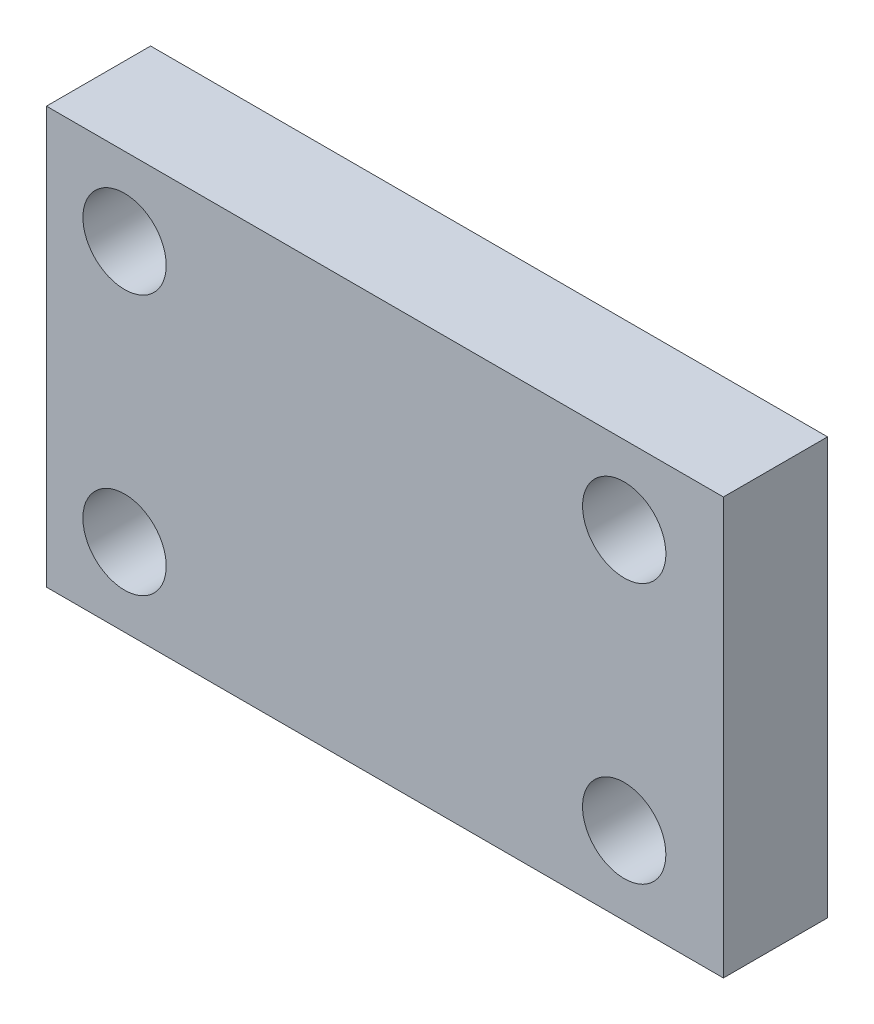
from build123d import *

# Parameters (mm, degrees)
ESBO_O3_W                = 130
ESBO_O3_H                = 80
RESSALTO_EXTRUS_O2_DEPTH = 20
ESBO_O4_R                = 8
CORTE_EXTRUS_O1_DEPTH    = 20


with BuildPart() as part:
    # Esboço3 → Ressalto-extrusão2 (new body)
    with BuildSketch(Plane.XY):
        Rectangle(ESBO_O3_W, ESBO_O3_H)
    extrude(amount=RESSALTO_EXTRUS_O2_DEPTH)

    # Esboço4 → Corte-extrusão1 (cut)
    with BuildSketch(Plane.XY.offset(20)):
        with Locations((-50, 25)):
            Circle(ESBO_O4_R)
        with Locations((45.947057794, 25)):
            Circle(ESBO_O4_R)
        with Locations((45.947057794, -25)):
            Circle(ESBO_O4_R)
        with Locations((-50, -25)):
            Circle(ESBO_O4_R)
    extrude(amount=-CORTE_EXTRUS_O1_DEPTH, mode=Mode.SUBTRACT)


solid = part.part
